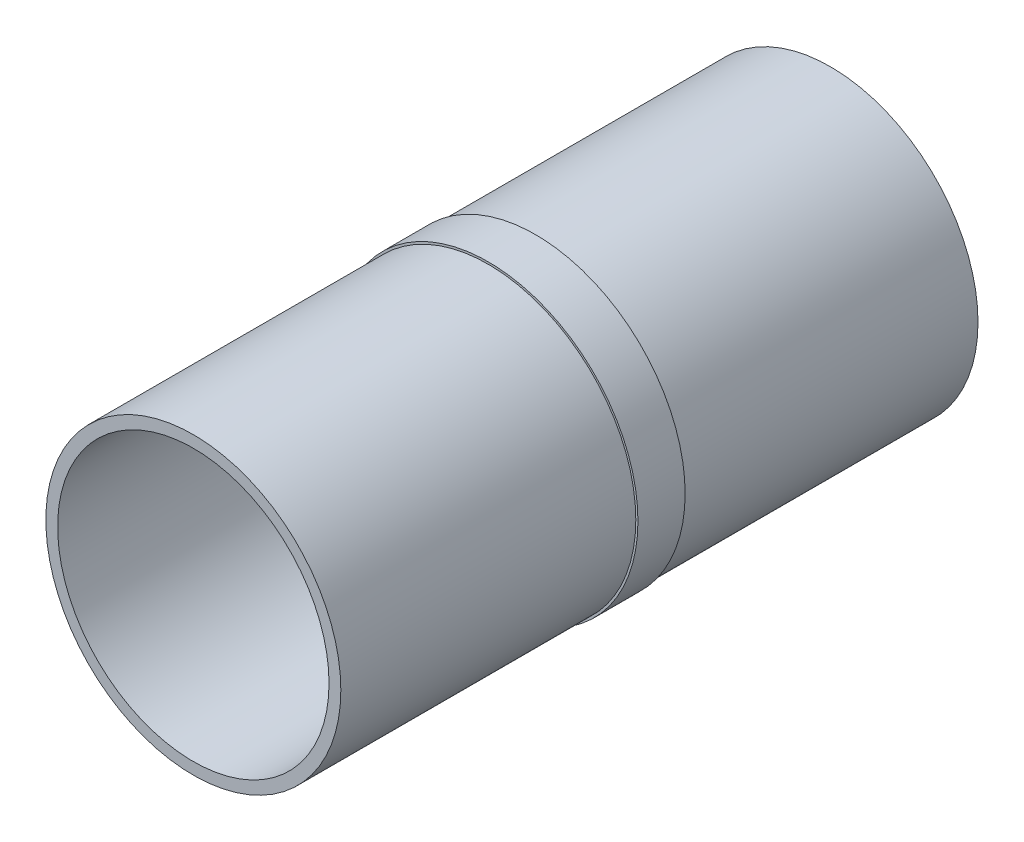
from build123d import *

# Parameters (mm, degrees)
SKETCH1_R           = 79.375
SKETCH1_R_2         = 73.025
BOSS_EXTRUDE1_DEPTH = 342.9
SKETCH2_R           = 80.518
SKETCH2_R_2         = 79.375
BOSS_EXTRUDE2_DEPTH = 12.7


with BuildPart() as part:
    # Sketch1 → Boss-Extrude1 (new body)
    with BuildSketch(Plane.XY):
        Circle(SKETCH1_R)
        Circle(SKETCH1_R_2, mode=Mode.SUBTRACT)
    extrude(amount=BOSS_EXTRUDE1_DEPTH)

    # Sketch2 → Boss-Extrude2 (add, symmetric)
    with BuildSketch(Plane.XY.offset(171.45)):
        Circle(SKETCH2_R)
        Circle(SKETCH2_R_2, mode=Mode.SUBTRACT)
    extrude(amount=BOSS_EXTRUDE2_DEPTH, both=True)


solid = part.part
